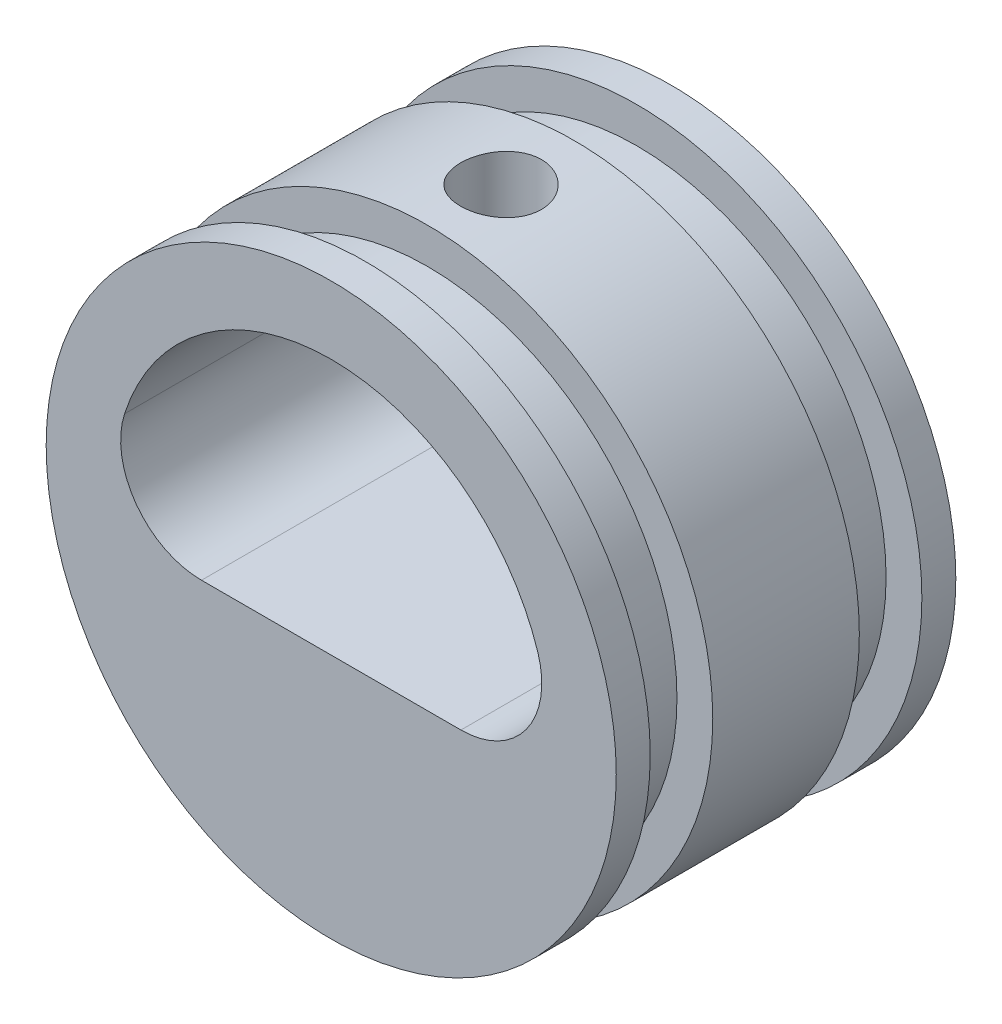
from build123d import *

# Parameters (mm, degrees)
SKETCH1_R                          = 16.7894
BOSS_EXTRUDE1_DEPTH                = 20
SKETCH2_W                          = 3.683
SKETCH2_H                          = 2.1082
CUT_EXTRUDE1_DEPTH                 = 32.044611525
FILLET1_R                          = 4.7625
F_3_16_0_1875_DIAMETER_HOLE1_D     = 4.7625
F_3_16_0_1875_DIAMETER_HOLE1_DEPTH = 11.543700016
F_3_16_0_1875_DIAMETER_HOLE1_TIP   = 1.430799349


with BuildPart() as part:
    # Sketch1 → Boss-Extrude1 (new body)
    with BuildSketch(Plane.XY):
        Circle(SKETCH1_R)
    extrude(amount=BOSS_EXTRUDE1_DEPTH)

    # Sketch2 → Cut-Revolve1 (revolve, cut)
    with BuildSketch(Plane(origin=(0, 0, 0), x_dir=(0, 0, -1), z_dir=(1, 0, 0))):
        with Locations((-16.1585, 15.7353)):
            Rectangle(SKETCH2_W, SKETCH2_H)
        with Locations((-3.8415, 15.7353)):
            Rectangle(SKETCH2_W, SKETCH2_H)
    revolve(axis=Axis((0, 0, 21.240749408), (0, 0, -1)), mode=Mode.SUBTRACT)

    # Sketch3 → Cut-Extrude1 (cut, through all)
    with BuildSketch(Plane.XY.offset(20)):
        with BuildLine():
            Line((-12.580888371, -2.300000032), (12.580888371, -2.300000032))
            ThreePointArc((12.580888371, -2.300000032), (0, 12.7894), (-12.580888371, -2.300000032))
        make_face()
    extrude(amount=-CUT_EXTRUDE1_DEPTH, mode=Mode.SUBTRACT)

    # Fillet1
    fillet1_edges = [part.edges().sort_by_distance(p)[0] for p in [
        (-12.580888371, -2.300000032, 10),
        (12.580888371, -2.300000032, 10),
    ]]
    fillet(fillet1_edges, radius=FILLET1_R)

    # 3/16 (0.1875) Diameter Hole1
    with Locations(Plane(origin=(0, 16.7894, 0), x_dir=(-1, 0, 0), z_dir=(0, 1, 0))):
        with Locations((0, 10)):
            Hole(F_3_16_0_1875_DIAMETER_HOLE1_D / 2, depth=F_3_16_0_1875_DIAMETER_HOLE1_DEPTH)
            with Locations((0, 0, -(F_3_16_0_1875_DIAMETER_HOLE1_DEPTH + F_3_16_0_1875_DIAMETER_HOLE1_TIP / 2))):  # 118° drill point
                Cone(0, F_3_16_0_1875_DIAMETER_HOLE1_D / 2, F_3_16_0_1875_DIAMETER_HOLE1_TIP, mode=Mode.SUBTRACT)


solid = part.part
